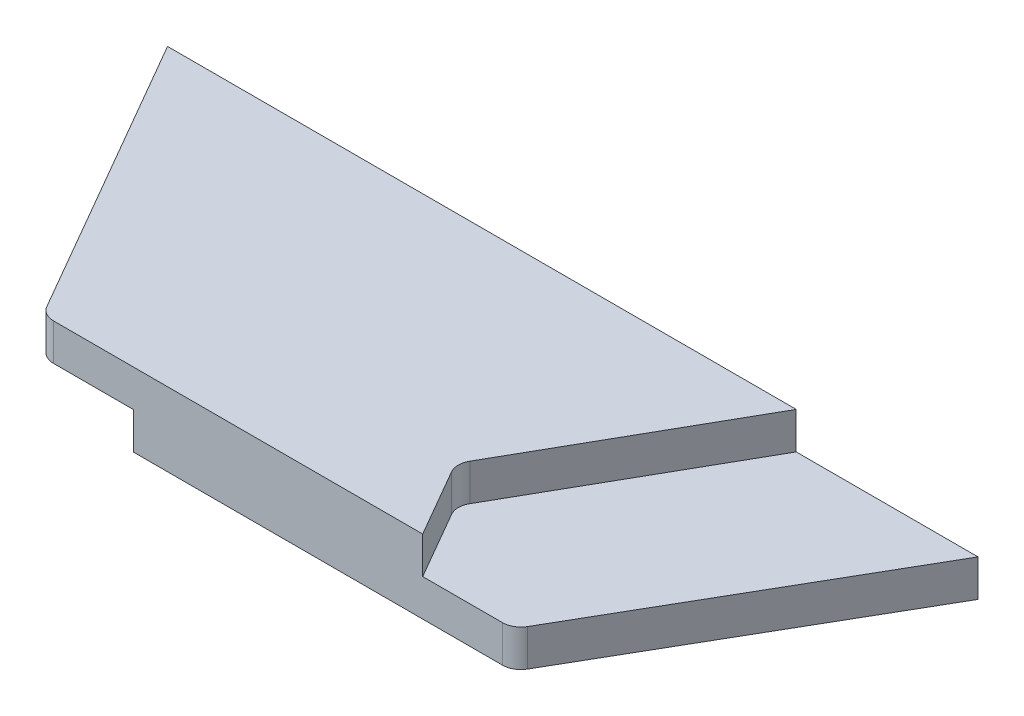
from build123d import *

# Parameters (mm, degrees)
SKETCH_1_W          = 80
SKETCH_1_H          = 20
EXTRUDE_1_DEPTH     = 220
CUT_EXTRUDE_1_DEPTH = 10
CUT_EXTRUDE_2_DEPTH = 10
SKETCH_4_OUTSIDE_W  = 268.99
SKETCH_4_OUTSIDE_H  = 128.99
CUT_EXTRUDE_4_DEPTH = 235.946802489


with BuildPart() as part:
    # Эскиз1 → Бобышка-Вытянуть1 (new body)
    with BuildSketch(Plane(origin=(0, 0, 0), x_dir=(0, 0, -1), z_dir=(1, 0, 0))):
        with Locations((40, 10)):
            Rectangle(SKETCH_1_W, SKETCH_1_H)
    extrude(amount=EXTRUDE_1_DEPTH)

    # Эскиз2 → Вырез-Вытянуть1 (cut)
    with BuildSketch(Plane.XZ):
        with BuildLine():
            Line((49.75, -80), (0, -80))
            Line((0, -80), (0, 0))
            Line((0, 0), (70.740181695, 0))
            Line((70.740181695, 0), (81.948051278, -19.412599562))
            ThreePointArc((81.948051278, -19.412599562), (82.617923015, -21.916126815), (81.944519716, -24.418706453))
            Line((81.944519716, -24.418706453), (49.75, -80))
        make_face()
    extrude(amount=-CUT_EXTRUDE_1_DEPTH, mode=Mode.SUBTRACT)

    # Эскиз3 → Вырез-Вытянуть2 (cut)
    with BuildSketch(Plane(origin=(0, 20, 0), x_dir=(1, 0, 0), z_dir=(0, 1, 0))):
        with BuildLine():
            Line((138.531165549, 23.527492185), (170.657560268, 80))
            Line((170.657560268, 80), (220, 80))
            Line((220, 80), (220, 0))
            Line((220, 0), (149.259818305, 0))
            Line((149.259818305, 0), (138.547007026, 18.555133427))
            ThreePointArc((138.547007026, 18.555133427), (137.87715942, 21.039203968), (138.531165549, 23.527492185))
        make_face()
    extrude(amount=-CUT_EXTRUDE_2_DEPTH, mode=Mode.SUBTRACT)

    # Эскиз4 outside → Вырез-Вытянуть4 (cut, through all)
    with BuildSketch(Plane(origin=(0, 20, 0), x_dir=(1, 0, 0), z_dir=(0, 1, 0))):
        with Locations((110, 40)):
            Rectangle(SKETCH_4_OUTSIDE_W, SKETCH_4_OUTSIDE_H)
        with BuildLine():
            Line((220, 80), (175.255354138, 2.5))
            ThreePointArc((175.255354138, 2.5), (173.425227119, 0.669872981), (170.925227119, 0))
            Line((170.925227119, 0), (49.074772881, 0))
            ThreePointArc((49.074772881, 0), (46.574772881, 0.669872981), (44.744645862, 2.5))
            Line((44.744645862, 2.5), (0, 80))
            Line((0, 80), (220, 80))
        make_face(mode=Mode.SUBTRACT)
    extrude(amount=-CUT_EXTRUDE_4_DEPTH, mode=Mode.SUBTRACT)


solid = part.part
